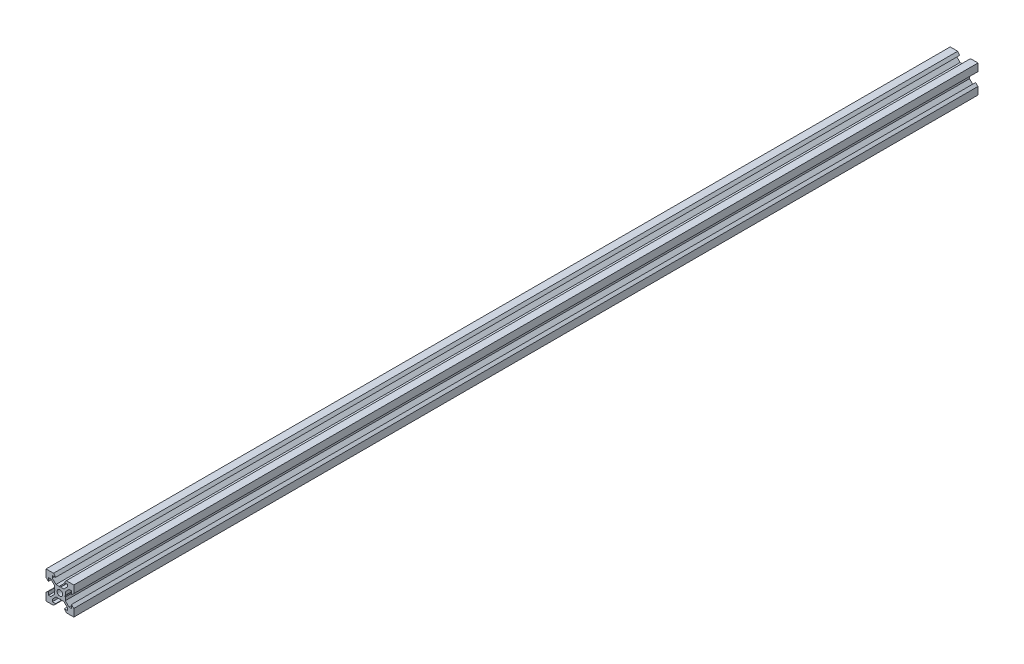
from build123d import *

# Parameters (mm, degrees)
SKETCH1_R           = 2
BOSS_EXTRUDE1_DEPTH = 325


with BuildPart() as part:
    # Sketch1 → Boss-Extrude1 (new, symmetric)
    with BuildSketch(Plane.XY):
        Polygon((10, 4.610379336), (10, 10), (4.610379336, 10), (3.1, 8.2), (5.5, 8.2), (5.5, 6.560660172), (2.839339828, 3.9), (0.519615242, 3.9), (0, 3.6), (-0.519615242, 3.9), (-2.839339828, 3.9), (-5.5, 6.560660172), (-5.5, 8.2), (-3.1, 8.2), (-4.610379336, 10), (-10, 10), (-10, 4.610379336), (-8.2, 3.1), (-8.2, 5.5), (-6.560660172, 5.5), (-3.9, 2.839339828), (-3.9, 0.519615242), (-3.6, 0), (-3.9, -0.519615242), (-3.9, -2.839339828), (-6.560660172, -5.5), (-8.2, -5.5), (-8.2, -3.1), (-10, -4.610379336), (-10, -10), (-4.610379336, -10), (-3.1, -8.2), (-5.5, -8.2), (-5.5, -6.560660172), (-2.839339828, -3.9), (-0.519615242, -3.9), (0, -3.6), (0.519615242, -3.9), (2.839339828, -3.9), (5.5, -6.560660172), (5.5, -8.2), (3.1, -8.2), (4.610379336, -10), (10, -10), (10, -4.610379336), (8.2, -3.1), (8.2, -5.5), (6.560660172, -5.5), (3.9, -2.839339828), (3.9, -0.519615242), (3.6, 0), (3.9, 0.519615242), (3.9, 2.839339828), (6.560660172, 5.5), (8.2, 5.5), (8.2, 3.1), align=None)
        Circle(SKETCH1_R, mode=Mode.SUBTRACT)
    extrude(amount=BOSS_EXTRUDE1_DEPTH, both=True)


solid = part.part
